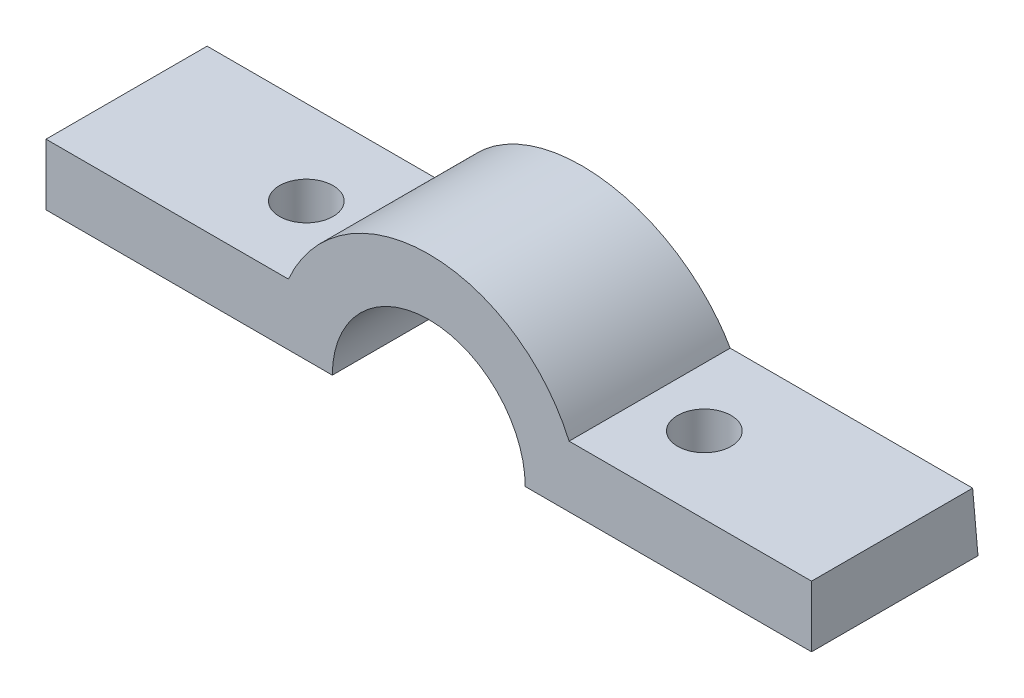
from build123d import *

# Parameters (mm, degrees)
BOSS_EXTRUDE2_DEPTH    = 13.80744
CUT_EXTRUDE1_START     = -0.02543021
CUT_EXTRUDE1_OUTLINE_W = 66
CUT_EXTRUDE1_OUTLINE_H = 16
CUT_EXTRUDE1_DEPTH     = 1.106877933
CUT_EXTRUDE2_REACH     = 39.046
SKETCH4_R              = 2.2225


# Read off the part's stored shape, not the designer's step: Cut-Extrude1
with BuildPart() as part:
    # Sketch2 → Boss-Extrude2 (new body)
    with BuildSketch(Plane.XY):
        with BuildLine():
            ThreePointArc((-11.445222977, 4.788221067), (-12.237590886, 2.302953542), (-12.505480711, -0.291778933))
            Line((-12.505480711, -0.291778933), (-7.805480711, -0.291778933))
            ThreePointArc((-7.805480711, -0.291778933), (0.194519289, 7.708221067), (8.194519289, -0.291778933))
            Line((8.194519289, -0.291778933), (12.894519289, -0.291778933))
            ThreePointArc((12.894519289, -0.291778933), (12.626629463, 2.302953542), (11.834261554, 4.788221067))
            ThreePointArc((11.834261554, 4.788221067), (0.194519289, 12.408221067), (-11.445222977, 4.788221067))
        make_face()
        with BuildLine():
            Line((-31.555480711, -0.291778933), (-12.505480711, -0.291778933))
            ThreePointArc((-12.505480711, -0.291778933), (-12.237590886, 2.302953542), (-11.445222977, 4.788221067))
            Line((-11.445222977, 4.788221067), (-31.555480711, 4.788221067))
            Line((-31.555480711, 4.788221067), (-31.555480711, -0.291778933))
        make_face()
        with BuildLine():
            ThreePointArc((11.834261554, 4.788221067), (12.626629463, 2.302953542), (12.894519289, -0.291778933))
            Line((12.894519289, -0.291778933), (31.944519289, -0.291778933))
            Line((31.944519289, -0.291778933), (31.944519289, 4.788221067))
            Line((31.944519289, 4.788221067), (11.834261554, 4.788221067))
        make_face()
    extrude(amount=BOSS_EXTRUDE2_DEPTH)

    # Cut-Extrude1 outline → Cut-Extrude1 (cut)
    with BuildSketch(Plane(origin=(0, 0, 0), x_dir=(1, 0, 0), z_dir=(0, 0.08715574274765836, -0.9961946980917455)).offset(CUT_EXTRUDE1_START)):
        with Locations((0, -6)):
            Rectangle(CUT_EXTRUDE1_OUTLINE_W, CUT_EXTRUDE1_OUTLINE_H)
    extrude(amount=CUT_EXTRUDE1_DEPTH, mode=Mode.SUBTRACT)

    # Sketch4 → Cut-Extrude2 (cut, up to next)
    with BuildSketch(Plane.XZ.offset(0.291778933), mode=Mode.PRIVATE) as cut_extrude2_sk1:
        with Locations(Location((-16.315480711, 7.45744, 0), (0, 0, 270))):
            Circle(SKETCH4_R)
    cut_extrude2_tool1 = extrude(cut_extrude2_sk1.sketch, amount=-CUT_EXTRUDE2_REACH, mode=Mode.PRIVATE) & part.part
    # Sketch4 → Cut-Extrude2 (cut, up to next)
    with BuildSketch(Plane.XZ.offset(0.291778933), mode=Mode.PRIVATE) as cut_extrude2_sk2:
        with Locations(Location((16.704519289, 7.45744, 0), (0, 0, 270))):
            Circle(SKETCH4_R)
    cut_extrude2_tool2 = extrude(cut_extrude2_sk2.sketch, amount=-CUT_EXTRUDE2_REACH, mode=Mode.PRIVATE) & part.part
    add(cut_extrude2_tool1.solids().sort_by_distance((-16.315481, -0.291779, 7.45744))[0], mode=Mode.SUBTRACT)
    add(cut_extrude2_tool2.solids().sort_by_distance((16.704519, -0.291779, 7.45744))[0], mode=Mode.SUBTRACT)


solid = part.part
